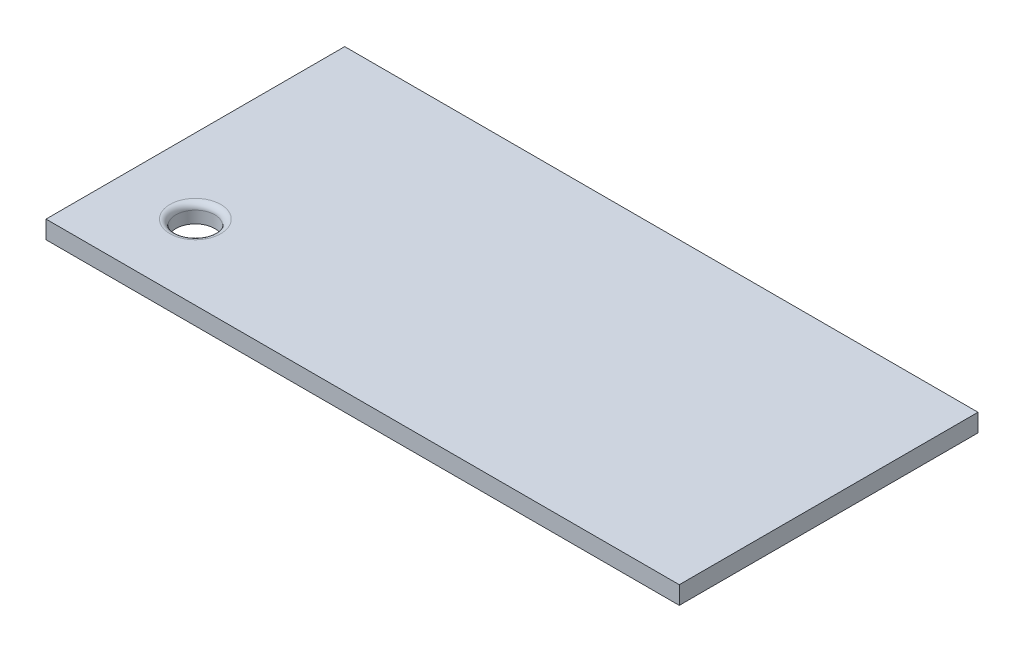
from build123d import *

# Parameters (mm, degrees)
SKETCH1_W           = 212
SKETCH1_H           = 100
BOSS_EXTRUDE1_DEPTH = 6
SKETCH2_R           = 6.5
CUT_EXTRUDE1_DEPTH  = 235.478143971
FILLET1_R           = 2


with BuildPart() as part:
    # Sketch1 → Boss-Extrude1 (new body)
    with BuildSketch(Plane(origin=(0, 0, 0), x_dir=(1, 0, 0), z_dir=(0, 1, 0))):
        with Locations((106, 50)):
            Rectangle(SKETCH1_W, SKETCH1_H)
    extrude(amount=BOSS_EXTRUDE1_DEPTH)

    # Sketch2 → Cut-Extrude1 (cut, through all)
    with BuildSketch(Plane(origin=(0, 6, 0), x_dir=(1, 0, 0), z_dir=(0, 1, 0))):
        with Locations((25, 25)):
            Circle(SKETCH2_R)
    extrude(amount=-CUT_EXTRUDE1_DEPTH, mode=Mode.SUBTRACT)

    # Fillet1
    fillet1_edges = [part.edges().sort_by_distance(p)[0] for p in [
        (18.5, 6, -25),
    ]]
    fillet(fillet1_edges, radius=FILLET1_R)


solid = part.part
